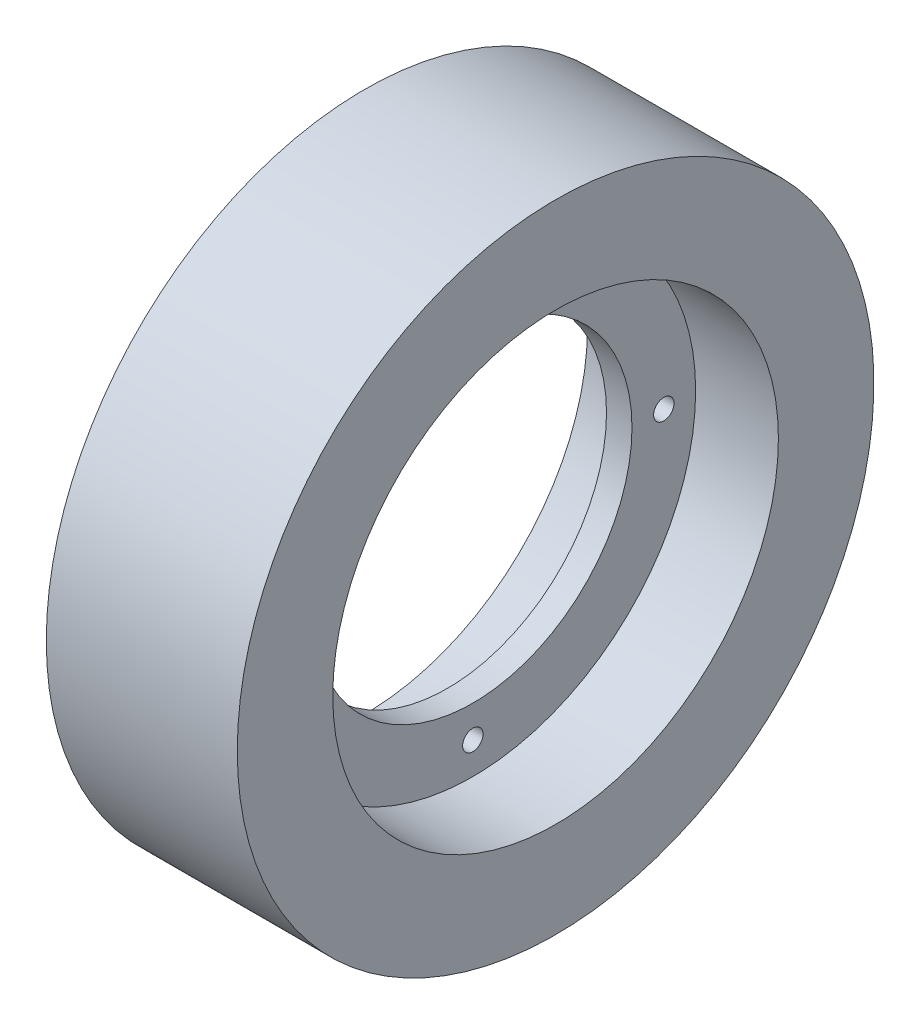
from build123d import *

# Parameters (mm, degrees)
SKETCH3_R          = 1.6
CUT_EXTRUDE1_DEPTH = 73.725511342
CIRPATTERN1_COUNT  = 4


with BuildPart() as part:
    # Sketch2 → Revolve1 (revolve)
    with BuildSketch(Plane.XY):
        Polygon((15, 50), (-15, 50), (-15, 35), (-2, 35), (-2, 25), (2, 25), (2, 35), (15, 35), align=None)
    revolve(axis=Axis((0, 0, 0), (1, 0, 0)))

    # Sketch3 → Cut-Extrude1 (cut, through all)
    with BuildSketch(Plane(origin=(2, 0, 0), x_dir=(0, 0, -1), z_dir=(1, 0, 0))):
        with Locations((0, 30)):
            Circle(SKETCH3_R)
    cut_extrude1 = extrude(amount=-CUT_EXTRUDE1_DEPTH, mode=Mode.SUBTRACT)

    # CirPattern1: Cut-Extrude1 ×4 about axis
    cirpattern1_axis = Axis((2, 0, 0), (-1, 0, 0))
    for i in range(1, CIRPATTERN1_COUNT):
        add(cut_extrude1.rotate(cirpattern1_axis, i * 360 / CIRPATTERN1_COUNT), mode=Mode.SUBTRACT)


solid = part.part
